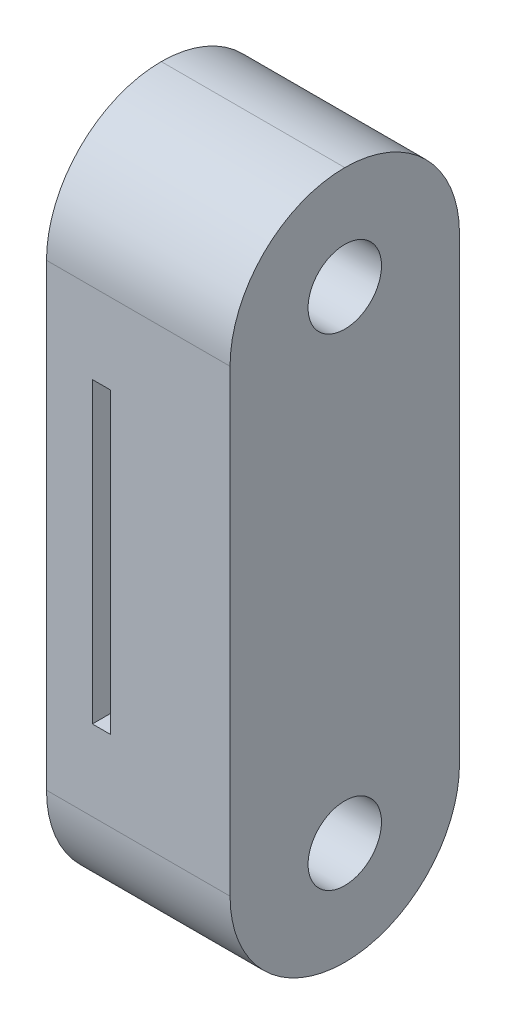
from build123d import *

# Parameters (mm, degrees)
SKIZZE1_W                            = 8
SKIZZE1_H                            = 30
AUFSATZ_LINEAR_AUSTRAGEN1_DEPTH      = 5
SKIZZE4_R                            = 1.6
SCHNITT_LINEAR_AUSTRAGEN4_DEPTH      = 18.720045147
VERRUNDUNG1_R                        = 5
SCHNITT_LINEAR_AUSTRAGEN5_DEPTH      = 18.720045147
SCHNITT_LINEAR_AUSTRAGEN5_DEPTH_BACK = 18.720045147
SKIZZE5_W                            = 0.8
SKIZZE5_H                            = 13


with BuildPart() as part:
    # Skizze1 → Aufsatz-Linear austragen1 (new, symmetric)
    with BuildSketch(Plane.XY):
        with Locations((-4, 0)):
            Rectangle(SKIZZE1_W, SKIZZE1_H)
    extrude(amount=AUFSATZ_LINEAR_AUSTRAGEN1_DEPTH, both=True)

    # Skizze4 → Schnitt-Linear austragen4 (cut, through all)
    with BuildSketch(Plane(origin=(0, 0, 0), x_dir=(0, 0, -1), z_dir=(1, 0, 0))):
        with Locations((0, 10.5)):
            Circle(SKIZZE4_R)
        with Locations((0, -10.5)):
            Circle(SKIZZE4_R)
    extrude(amount=-SCHNITT_LINEAR_AUSTRAGEN4_DEPTH, mode=Mode.SUBTRACT)

    # Verrundung1
    verrundung1_edges = [part.edges().sort_by_distance(p)[0] for p in [
        (-4, 15, 5),
        (-4, 15, -5),
        (-4, -15, 5),
        (-4, -15, -5),
    ]]
    fillet(verrundung1_edges, radius=VERRUNDUNG1_R - 0.0001)  # a hair under: the kernel refuses the full size

    # Skizze5 → Schnitt-Linear austragen5 (cut, two sides: drawn at the far end of the back side and taken through both)
    with BuildSketch(Plane.XY.offset(-SCHNITT_LINEAR_AUSTRAGEN5_DEPTH_BACK)):
        with Locations((-5.6, 0)):
            Rectangle(SKIZZE5_W, SKIZZE5_H)
    extrude(amount=SCHNITT_LINEAR_AUSTRAGEN5_DEPTH + SCHNITT_LINEAR_AUSTRAGEN5_DEPTH_BACK, mode=Mode.SUBTRACT)


solid = part.part
